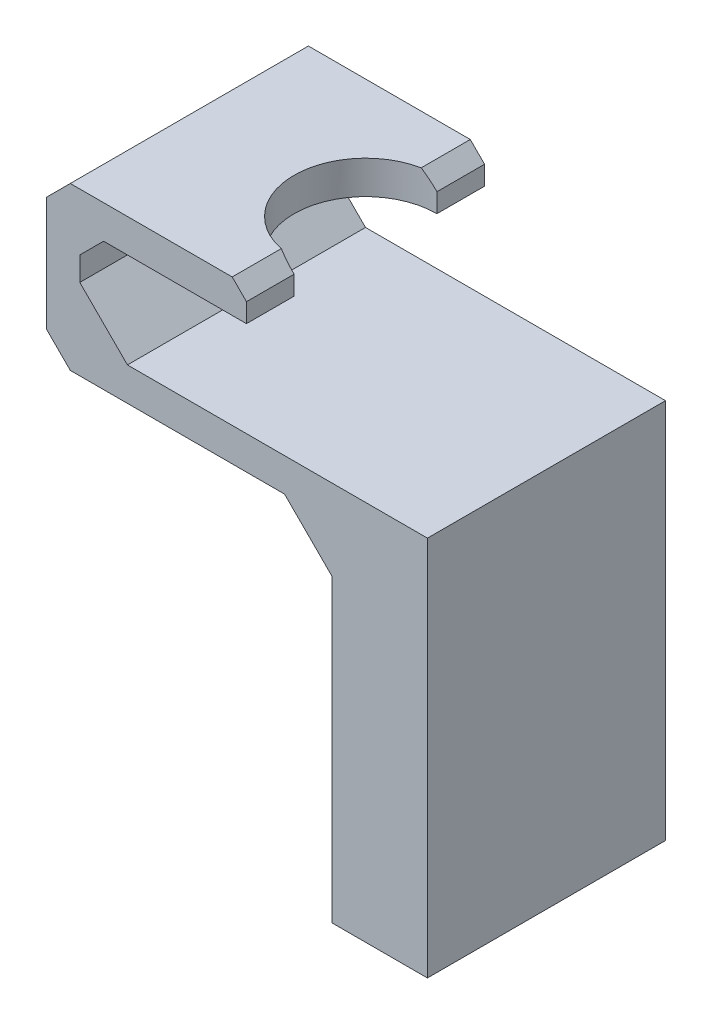
from build123d import *

# Parameters (mm, degrees)
BOSS_EXTRU_1_DEPTH      = 50
CHANFREIN1_SIZE         = 10
CHANFREIN2_SIZE         = 10
CHANFREIN3_SIZE         = 5
ESQUISSE3_R             = 15
ENL_V_MAT_EXTRU_1_DEPTH = 7
CHANFREIN4_SIZE         = 5
CHANFREIN5_SIZE         = 5
CHANFREIN6_SIZE         = 3
CHANFREIN7_SIZE         = 3


with BuildPart() as part:
    # Esquisse1 → Boss.-Extru.1 (new body)
    with BuildSketch(Plane.XY):
        Polygon((-10.688564271, 25.294871795), (-52.688564271, 25.294871795), (-52.688564271, -8.705128205), (7.311435729, -8.705128205), (7.311435729, -81.705128205), (27.311435729, -81.705128205), (27.311435729, -1.705128205), (-45.688564271, -1.705128205), (-45.688564271, 18.294871795), (-10.688564271, 18.294871795), align=None)
    extrude(amount=-BOSS_EXTRU_1_DEPTH)

    # Chanfrein1
    chanfrein1_edges = [part.edges().sort_by_distance(p)[0] for p in [
        (-45.688564271, -1.705128205, -25),
    ]]
    chamfer(chanfrein1_edges, length=CHANFREIN1_SIZE)

    # Chanfrein2
    chanfrein2_edges = [part.edges().sort_by_distance(p)[0] for p in [
        (7.311435729, -8.705128205, -25),
    ]]
    chamfer(chanfrein2_edges, length=CHANFREIN2_SIZE)

    # Chanfrein3
    chanfrein3_edges = [part.edges().sort_by_distance(p)[0] for p in [
        (-45.688564271, 18.294871795, -25),
    ]]
    chamfer(chanfrein3_edges, length=CHANFREIN3_SIZE)

    # Esquisse3 → Enlèv. mat.-Extru.1 (cut)
    with BuildSketch(Plane(origin=(0, 25.294871795, 0), x_dir=(1, 0, 0), z_dir=(0, 1, 0))):
        with Locations((-10.688564271, 25)):
            Circle(ESQUISSE3_R)
    extrude(amount=-ENL_V_MAT_EXTRU_1_DEPTH, mode=Mode.SUBTRACT)

    # Chanfrein4
    chanfrein4_edges = [part.edges().sort_by_distance(p)[0] for p in [
        (-52.688564271, -8.705128205, -25),
    ]]
    chamfer(chanfrein4_edges, length=CHANFREIN4_SIZE)

    # Chanfrein5
    chanfrein5_edges = [part.edges().sort_by_distance(p)[0] for p in [
        (-52.688564271, 25.294871795, -25),
    ]]
    chamfer(chanfrein5_edges, length=CHANFREIN5_SIZE)

    # Chanfrein6
    chanfrein6_edges = [part.edges().sort_by_distance(p)[0] for p in [
        (-10.688564271, 25.294871795, -5),
    ]]
    chamfer(chanfrein6_edges, length=CHANFREIN6_SIZE)

    # Chanfrein7
    chanfrein7_edges = [part.edges().sort_by_distance(p)[0] for p in [
        (-10.688564271, 25.294871795, -45),
    ]]
    chamfer(chanfrein7_edges, length=CHANFREIN7_SIZE)


solid = part.part
